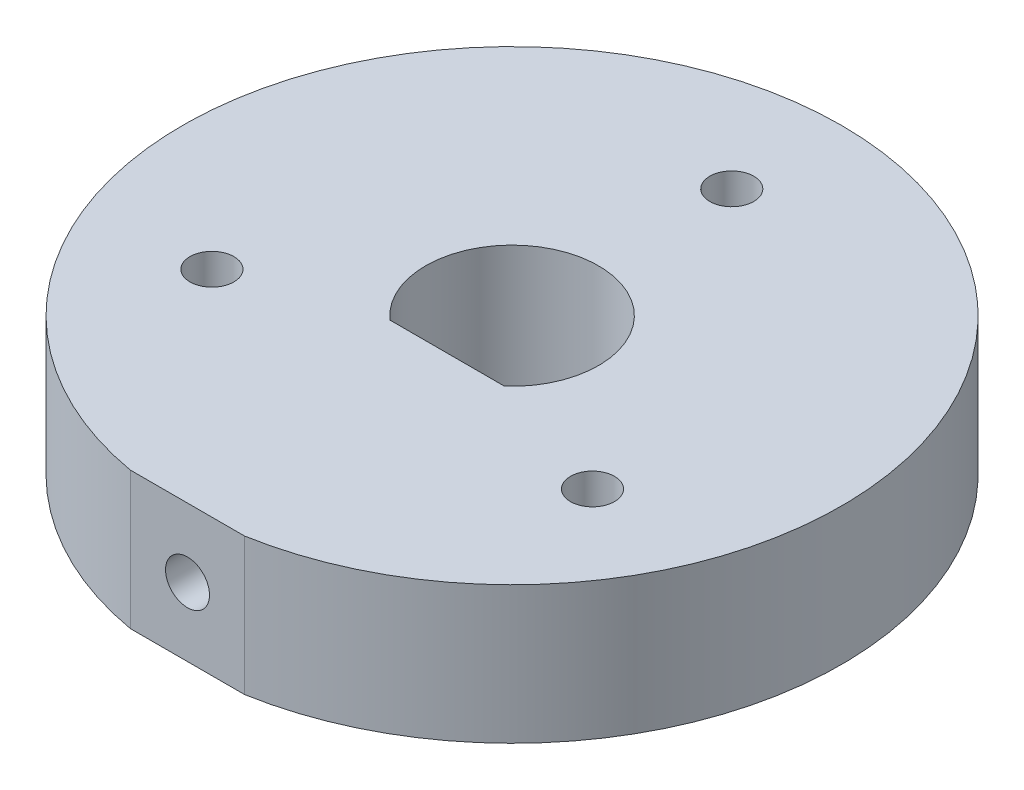
from build123d import *

# Parameters (mm, degrees)
SKETCH1_R           = 1.016
BOSS_EXTRUDE1_DEPTH = 6.35
CUT_EXTRUDE1_REACH  = 36.461
SKETCH2_R           = 1.016


with BuildPart() as part:
    # Sketch1 → Boss-Extrude1 (new body)
    with BuildSketch(Plane(origin=(0, 0, 0), x_dir=(1, 0, 0), z_dir=(0, 1, 0))):
        with BuildLine():
            Line((-2.645751311, -15.00858421), (2.645751311, -15.00858421))
            ThreePointArc((2.645751311, -15.00858421), (0, 15.24), (-2.645751311, -15.00858421))
        make_face()
        with Locations((0, 10.16)):
            Circle(SKETCH1_R, mode=Mode.SUBTRACT)
        with Locations((8.798818102, -5.08)):
            Circle(SKETCH1_R, mode=Mode.SUBTRACT)
        with Locations((-8.798818102, -5.08)):
            Circle(SKETCH1_R, mode=Mode.SUBTRACT)
        with BuildLine():
            Line((-2.645751311, -3), (2.645751311, -3))
            ThreePointArc((2.645751311, -3), (0, 4), (-2.645751311, -3))
        make_face(mode=Mode.SUBTRACT)
    extrude(amount=BOSS_EXTRUDE1_DEPTH)

    # Sketch2 → Cut-Extrude1 (cut, up to next)
    with BuildSketch(Plane.XY.offset(15.00858421), mode=Mode.PRIVATE) as cut_extrude1_sk1:
        with Locations((0, 3.175)):
            Circle(SKETCH2_R)
    cut_extrude1_tool1 = extrude(cut_extrude1_sk1.sketch, amount=-CUT_EXTRUDE1_REACH, mode=Mode.PRIVATE) & part.part
    add(cut_extrude1_tool1.solids().sort_by_distance((0, 3.175, 15.008584))[0], mode=Mode.SUBTRACT)


solid = part.part
